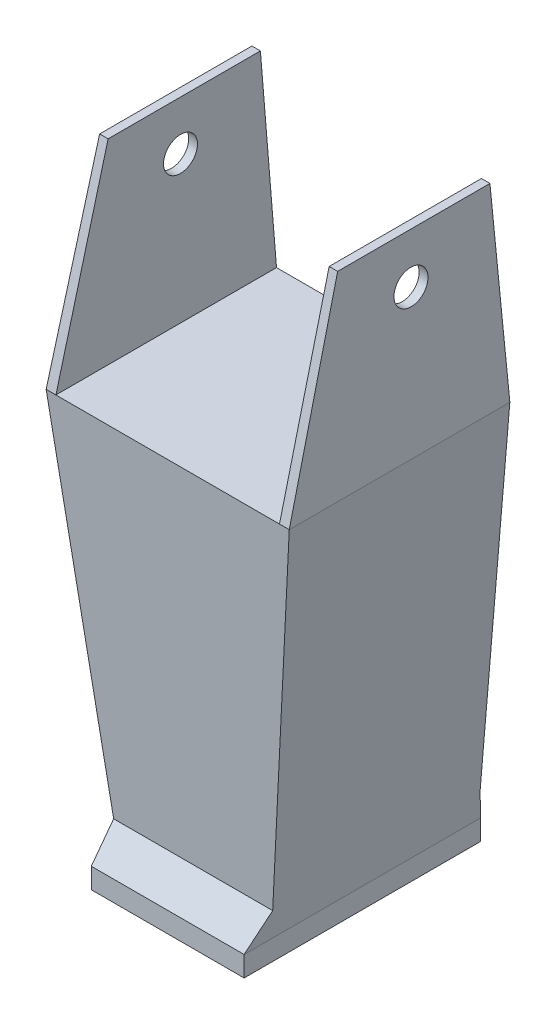
from build123d import *

# Parameters (mm, degrees)
BOSS_EXTRUDE1_DEPTH     = 71.58
CUT_EXTRUDE2_DEPTH      = 136.85530183
CUT_EXTRUDE2_DEPTH_BACK = 136.85530183
CUT_EXTRUDE3_DEPTH      = 136.85530183
CUT_EXTRUDE3_DEPTH_BACK = 136.85530183
CUT_EXTRUDE4_DEPTH      = 136.85530183
CUT_EXTRUDE4_DEPTH_BACK = 136.85530183
SKETCH16_R              = 5
CUT_EXTRUDE11_DEPTH     = 136.85530183
SKETCH17_W              = 45
SKETCH17_H              = 69.61
BOSS_EXTRUDE2_DEPTH     = 6
SKETCH18_R              = 4.9
BOSS_EXTRUDE3_DEPTH     = 10


with BuildPart() as part:
    # Sketch2 → Boss-Extrude1 (new body)
    with BuildSketch(Plane(origin=(0, 0, 0), x_dir=(0, 0, -1), z_dir=(1, 0, 0))):
        Polygon((-35.251160643, -109.956001694), (34.358839357, -109.956001694), (33.316287702, -102.063950804), (29.698839357, 5.004872941), (24.583736048, 63.004872941), (-20.256263952, 63.004872941), (-35.251160643, 5.004872941), (-27.753712298, -102.063950804), align=None)
    extrude(amount=BOSS_EXTRUDE1_DEPTH)

    # Sketch4 → Cut-Extrude2 (cut, two sides: drawn at the far end of the back side and taken through both)
    with BuildSketch(Plane.XY.offset(-CUT_EXTRUDE2_DEPTH_BACK)):
        Polygon((58.29, -109.956001694), (71.58, 5.004872941), (71.58, -109.956001694), align=None)
        Polygon((0, 5.004872941), (13.29, -109.956001694), (0, -109.956001694), align=None)
    extrude(amount=CUT_EXTRUDE2_DEPTH + CUT_EXTRUDE2_DEPTH_BACK, mode=Mode.SUBTRACT)

    # Sketch5 → Cut-Extrude3 (cut, two sides: drawn at the far end of the back side and taken through both)
    with BuildSketch(Plane.XY.offset(-CUT_EXTRUDE3_DEPTH_BACK)):
        Polygon((0, 5.004872941), (0, 63.004872941), (0.75, 63.004872941), align=None)
        Polygon((71.58, 63.004872941), (70.83, 63.004872941), (71.58, 5.004872941), align=None)
    extrude(amount=CUT_EXTRUDE3_DEPTH + CUT_EXTRUDE3_DEPTH_BACK, mode=Mode.SUBTRACT)

    # Sketch9 → Cut-Extrude4 (cut, two sides: drawn at the far end of the back side and taken through both)
    with BuildSketch(Plane.XY.offset(-CUT_EXTRUDE4_DEPTH_BACK)):
        Polygon((3.25, 63.004872941), (68.33, 63.004872941), (68.705, 5.004872941), (2.875, 5.004872941), align=None)
    extrude(amount=CUT_EXTRUDE4_DEPTH + CUT_EXTRUDE4_DEPTH_BACK, mode=Mode.SUBTRACT)

    # Sketch16 → Cut-Extrude11 (cut, through all)
    with BuildSketch(Plane(origin=(0, 0, 0), x_dir=(0, 0, -1), z_dir=(1, 0, 0))):
        with Locations((1.149194348, 48.404872941)):
            Circle(SKETCH16_R)
    extrude(amount=CUT_EXTRUDE11_DEPTH, mode=Mode.SUBTRACT)

    # Sketch17 → Boss-Extrude2 (add)
    with BuildSketch(Plane.XZ.offset(109.956001694)):
        with Locations((35.79, 0.446160643)):
            Rectangle(SKETCH17_W, SKETCH17_H)
    extrude(amount=BOSS_EXTRUDE2_DEPTH)

    # Sketch18 → Boss-Extrude3 (add)
    with BuildSketch(Plane.XZ.offset(115.956001694)):
        with Locations((35.79, 0.446160643)):
            Circle(SKETCH18_R)
    extrude(amount=BOSS_EXTRUDE3_DEPTH)


solid = part.part
